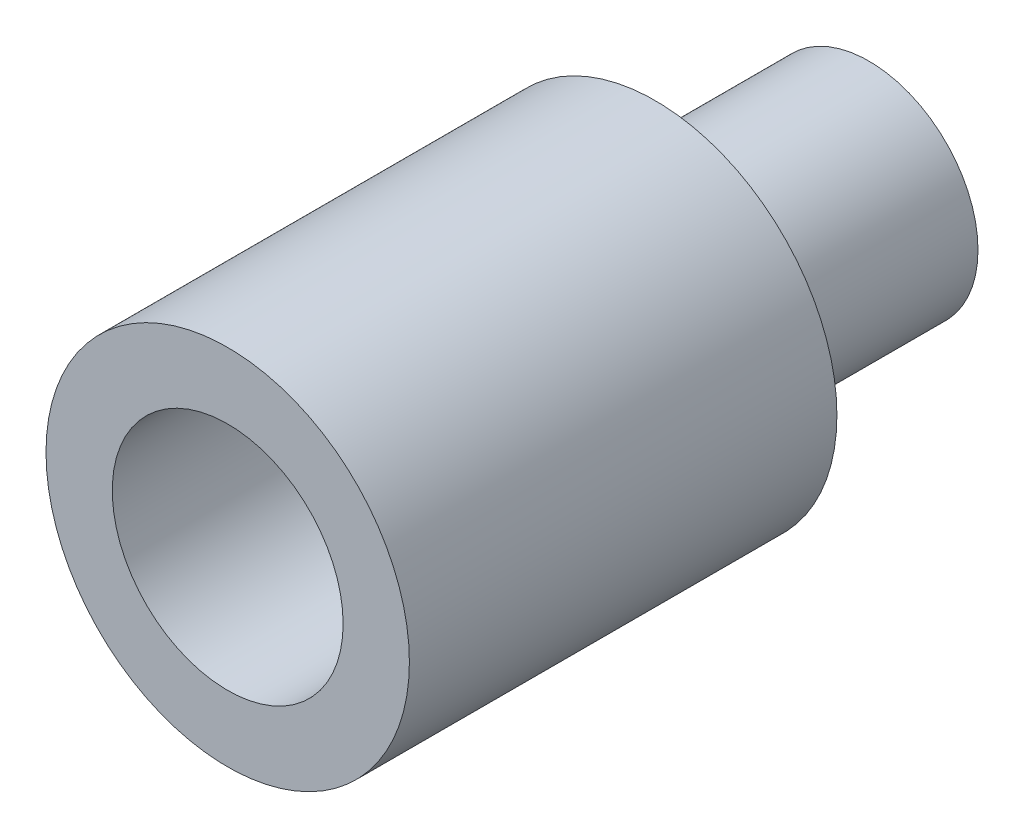
from build123d import *

# Parameters (mm, degrees)
SKETCH1_R           = 2.55
BOSS_EXTRUDE1_DEPTH = 5
SKETCH2_R           = 4.25
BOSS_EXTRUDE2_DEPTH = 10
SKETCH3_R           = 2.7
CUT_EXTRUDE1_DEPTH  = 8


with BuildPart() as part:
    # Sketch1 → Boss-Extrude1 (new body)
    with BuildSketch(Plane.XY):
        Circle(SKETCH1_R)
    extrude(amount=BOSS_EXTRUDE1_DEPTH)

    # Sketch2 → Boss-Extrude2 (add)
    with BuildSketch(Plane.XY.offset(5)):
        Circle(SKETCH2_R)
    extrude(amount=BOSS_EXTRUDE2_DEPTH)

    # Sketch3 → Cut-Extrude1 (cut)
    with BuildSketch(Plane.XY.offset(15)):
        Circle(SKETCH3_R)
    extrude(amount=-CUT_EXTRUDE1_DEPTH, mode=Mode.SUBTRACT)


solid = part.part
